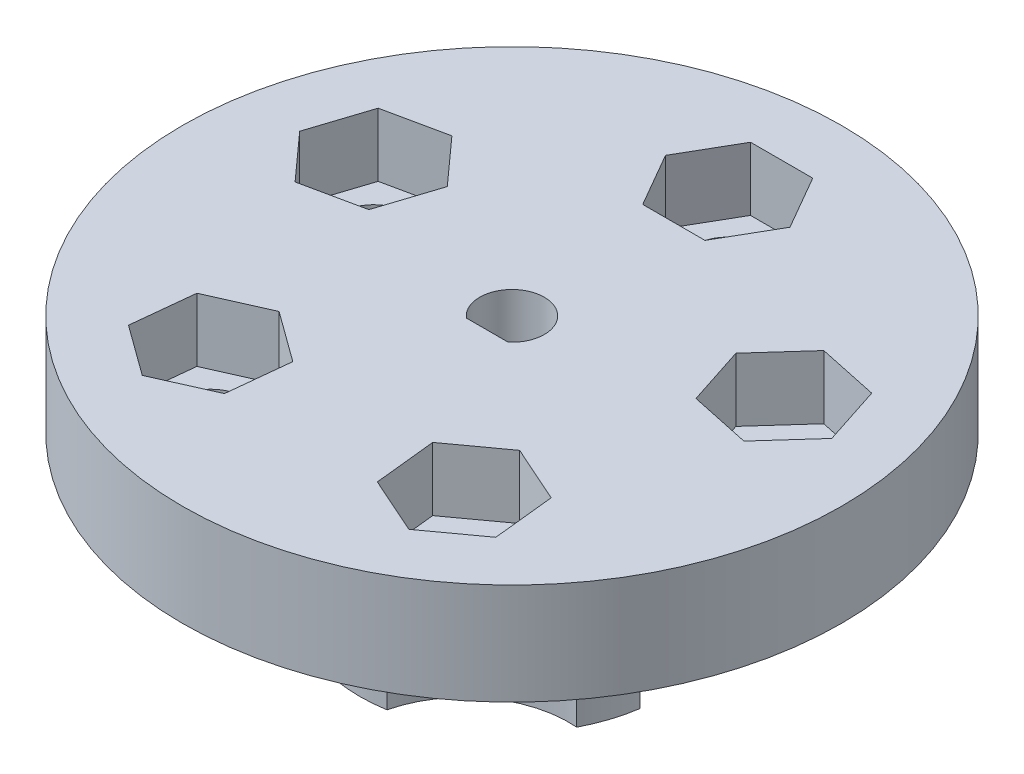
from build123d import *

# Parameters (mm, degrees)
SKETCH1_R           = 26
SKETCH1_R_2         = 2.65
BOSS_EXTRUDE1_DEPTH = 8
CUT_EXTRUDE1_DEPTH  = 5
CUT_EXTRUDE2_DEPTH  = 38.629775444
BOSS_EXTRUDE2_START = 12
BOSS_EXTRUDE2_DEPTH = 12
SKETCH5_R           = 1.75
CUT_EXTRUDE3_DEPTH  = 39.678159212
SKETCH6_R           = 2.75
CUT_EXTRUDE4_DEPTH  = 45.070965526
SKETCH7_W           = 6.2
SKETCH7_H           = 2.5
CUT_EXTRUDE5_DEPTH  = 10


with BuildPart() as part:
    # Sketch1 → Boss-Extrude1 (new body)
    with BuildSketch(Plane(origin=(0, 0, 0), x_dir=(1, 0, 0), z_dir=(0, 1, 0))):
        Circle(SKETCH1_R)
        with Locations((0, 17.013016167)):
            Circle(SKETCH1_R_2, mode=Mode.SUBTRACT)
        with Locations((-16.180339887, 5.257311121)):
            Circle(SKETCH1_R_2, mode=Mode.SUBTRACT)
        with Locations((-10, -13.763819205)):
            Circle(SKETCH1_R_2, mode=Mode.SUBTRACT)
        with Locations((10, -13.763819205)):
            Circle(SKETCH1_R_2, mode=Mode.SUBTRACT)
        with Locations((16.180339887, 5.257311121)):
            Circle(SKETCH1_R_2, mode=Mode.SUBTRACT)
    extrude(amount=BOSS_EXTRUDE1_DEPTH)

    # Sketch2 → Cut-Extrude1 (cut)
    with BuildSketch(Plane(origin=(0, 8, 0), x_dir=(1, 0, 0), z_dir=(0, 1, 0))):
        Polygon((-11.380102752, 6.277633022), (-14.663846006, 9.924599375), (-19.464083141, 8.904277474), (-20.980577023, 4.236989221), (-17.696833769, 0.590022868), (-12.896596634, 1.610344768), align=None)
        Polygon((4.907477288, 17.013016167), (2.453738644, 21.263016167), (-2.453738644, 21.263016167), (-4.907477288, 17.013016167), (-2.453738644, 12.763016167), (2.453738644, 12.763016167), align=None)
        Polygon((17.696833769, 0.590022868), (20.980577023, 4.236989221), (19.464083141, 8.904277474), (14.663846006, 9.924599375), (11.380102752, 6.277633022), (12.896596634, 1.610344768), align=None)
        Polygon((6.029767474, -16.648361981), (10.512971059, -18.644412819), (14.483203585, -15.759870043), (13.970232526, -10.879276429), (9.487028941, -8.883225591), (5.516796415, -11.767768367), align=None)
        Polygon((-13.970232526, -10.879276429), (-14.483203585, -15.759870043), (-10.512971059, -18.644412819), (-6.029767474, -16.648361981), (-5.516796415, -11.767768367), (-9.487028941, -8.883225591), align=None)
    extrude(amount=-CUT_EXTRUDE1_DEPTH, mode=Mode.SUBTRACT)

    # Sketch3 → Cut-Extrude2 (cut, through all)
    with BuildSketch(Plane.XZ):
        with BuildLine():
            Line((-1.643167673, 1.95), (1.643167673, 1.95))
            ThreePointArc((1.643167673, 1.95), (0, -2.55), (-1.643167673, 1.95))
        make_face()
    extrude(amount=-CUT_EXTRUDE2_DEPTH, mode=Mode.SUBTRACT)

    # Sketch4 → Boss-Extrude2 (add)
    with BuildSketch(Plane.XZ.offset(BOSS_EXTRUDE2_START)):
        with BuildLine():
            ThreePointArc((-10.645120134, 5.53908091), (-11.412678196, 3.708203932), (-11.867873166, 1.775834034))
            ThreePointArc((-11.867873166, 1.775834034), (-8.334123628, -2.707920918), (-8.557502023, -8.412440736))
            ThreePointArc((-8.557502023, -8.412440736), (-7.053423028, -9.708203932), (-5.356293025, -10.738255213))
            ThreePointArc((-5.356293025, -10.738255213), (0, -8.763016167), (5.356293025, -10.738255213))
            ThreePointArc((5.356293025, -10.738255213), (7.053423028, -9.708203932), (8.557502023, -8.412440736))
            ThreePointArc((8.557502023, -8.412440736), (8.334123628, -2.707920918), (11.867873166, 1.775834034))
            ThreePointArc((11.867873166, 1.775834034), (11.412678196, 3.708203932), (10.645120134, 5.53908091))
            ThreePointArc((10.645120134, 5.53908091), (5.150771669, 7.089429001), (1.978455965, 11.835781005))
            ThreePointArc((1.978455965, 11.835781005), (0, 12), (-1.978455965, 11.835781005))
            ThreePointArc((-1.978455965, 11.835781005), (-5.150771669, 7.089429001), (-10.645120134, 5.53908091))
        make_face()
        with BuildLine():
            Line((1.643167673, 1.95), (-1.643167673, 1.95))
            ThreePointArc((-1.643167673, 1.95), (0, -2.55), (1.643167673, 1.95))
        make_face(mode=Mode.SUBTRACT)
    extrude(amount=-BOSS_EXTRUDE2_DEPTH)

    # Sketch5 → Cut-Extrude3 (cut, through all)
    with BuildSketch(Plane.XY):
        with Locations((0, -6)):
            Circle(SKETCH5_R)
    extrude(amount=CUT_EXTRUDE3_DEPTH, mode=Mode.SUBTRACT)

    # Sketch6 → Cut-Extrude4 (cut, through all)
    with BuildSketch(Plane.XY.offset(7.5)):
        with Locations((0, -6)):
            Circle(SKETCH6_R)
    extrude(amount=CUT_EXTRUDE4_DEPTH, mode=Mode.SUBTRACT)

    # Sketch7 → Cut-Extrude5 (cut)
    with BuildSketch(Plane.XZ.offset(12)):
        with Locations((0, 5.2)):
            Rectangle(SKETCH7_W, SKETCH7_H)
    extrude(amount=-CUT_EXTRUDE5_DEPTH, mode=Mode.SUBTRACT)


solid = part.part
